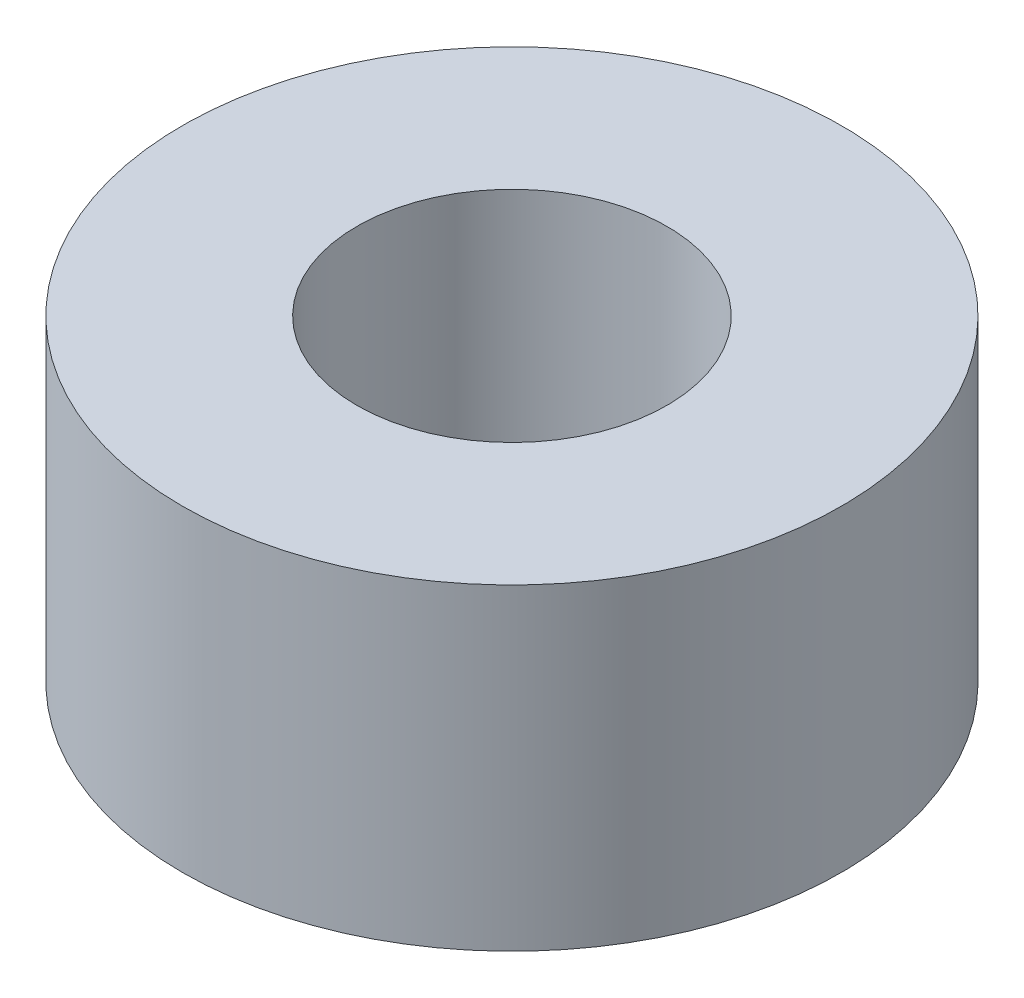
from build123d import *

# Parameters (mm, degrees)
SKETCH1_R           = 4.675
SKETCH1_R_2         = 2.2
BOSS_EXTRUDE1_DEPTH = 4.5


with BuildPart() as part:
    # Sketch1 → Boss-Extrude1 (new body)
    with BuildSketch(Plane(origin=(0, 0, 0), x_dir=(1, 0, 0), z_dir=(0, 1, 0))):
        Circle(SKETCH1_R)
        Circle(SKETCH1_R_2, mode=Mode.SUBTRACT)
    extrude(amount=BOSS_EXTRUDE1_DEPTH)


solid = part.part
